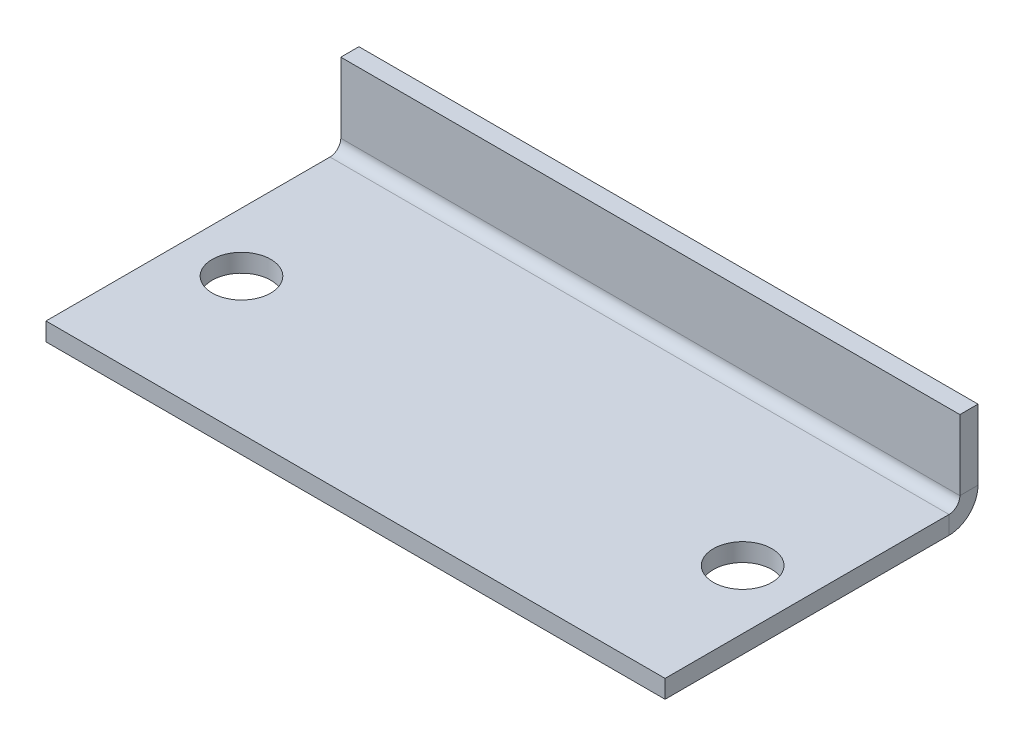
from build123d import *

# Parameters (mm, degrees)
SKETCH1_W                    = 42
SKETCH1_H                    = 1.23
BASE_FLANGE1_DEPTH           = 20
EDGE_FLANGE1_STRIP_W         = 6.3932
EDGE_FLANGE1_STRIP_H         = 1.23
EDGE_FLANGE1_STRIP_CUT_DEPTH = 42
EDGE_FLANGE1_DEPTH           = 42
SKETCH9_R                    = 1.984375
CUT_EXTRUDE1_DEPTH           = 30.516944286


# Sheet-metal steps are written as plain solids
with BuildPart() as part:
    # Sketch1 → Base-Flange1 (new body)
    with BuildSketch(Plane.XY):
        with Locations((0, -0.615)):
            Rectangle(SKETCH1_W, SKETCH1_H)
    extrude(amount=BASE_FLANGE1_DEPTH)

    # Edge-Flange1 strip (across the edge) → Edge-Flange1 strip cut (cut)
    with BuildSketch(Plane.ZY.offset(-21)):
        with Locations((-2.46, -0.615)):
            Rectangle(EDGE_FLANGE1_STRIP_W, EDGE_FLANGE1_STRIP_H)
    extrude(amount=EDGE_FLANGE1_STRIP_CUT_DEPTH, mode=Mode.SUBTRACT)

    # Edge-Flange1 section (across the edge) → Edge-Flange1 (add)
    with BuildSketch(Plane.ZY.offset(-21)):
        with BuildLine():
            Line((-1.23, 0.7366), (-1.23, 5.5))
            Line((-1.23, 5.5), (0, 5.5))
            Line((0, 5.5), (0, 0.7366))
            ThreePointArc((0, 0.7366), (0.215745145, 0.215745145), (0.7366, 0))
            Line((0.7366, 0), (0.7366, -1.23))
            ThreePointArc((0.7366, -1.23), (-0.653996196, -0.653996196), (-1.23, 0.7366))
        make_face()
    extrude(amount=EDGE_FLANGE1_DEPTH)

    # Sketch9 → Cut-Extrude1 (cut, through all)
    with BuildSketch(Plane(origin=(0, 0, 0), x_dir=(1, 0, 0), z_dir=(0, 1, 0))):
        with Locations(Location((-17, -10.7366, 0), (0, 0, 180))):
            Circle(SKETCH9_R)
    cut_extrude1 = extrude(amount=-CUT_EXTRUDE1_DEPTH, mode=Mode.SUBTRACT)

    # Mirror1: Cut-Extrude1 across plane
    add(cut_extrude1.mirror(Plane(origin=(0, 0, 0), x_dir=(0, 0, 1), z_dir=(1, 0, 0))), mode=Mode.SUBTRACT)


solid = part.part
